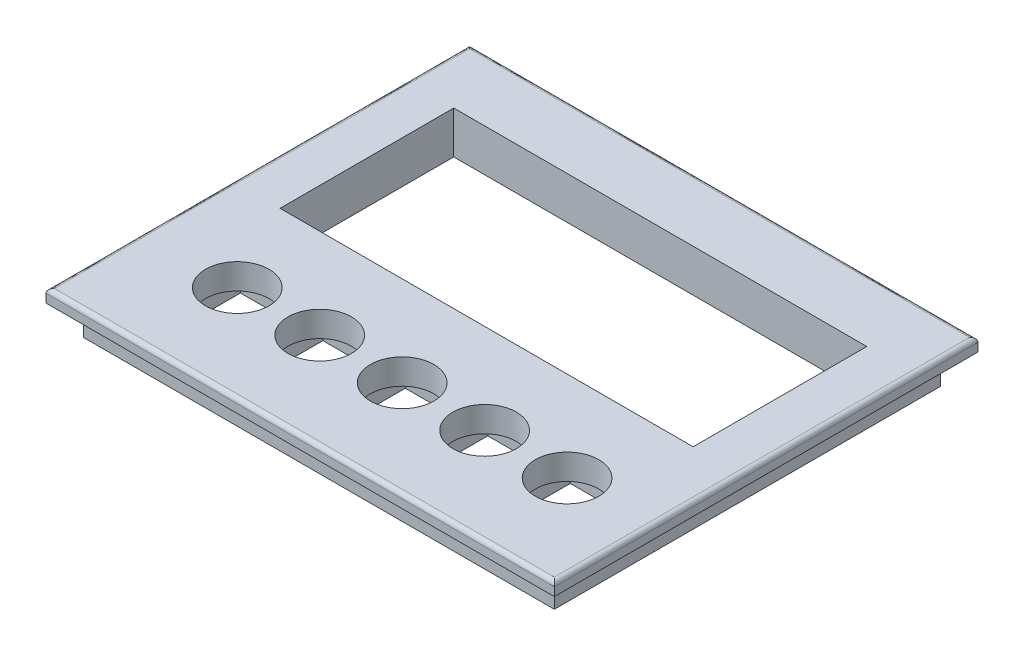
from build123d import *

# Parameters (mm, degrees)
SKETCH1_W           = 120
SKETCH1_H           = 100
BOSS_EXTRUDE1_DEPTH = 10
SKETCH2_W           = 97.5
SKETCH2_H           = 41
CUT_EXTRUDE1_DEPTH  = 10
SKETCH3_W           = 120
SKETCH3_H           = 100
SKETCH3_W_2         = 111.2
SKETCH3_H_2         = 91.2
CUT_EXTRUDE3_DEPTH  = 7
SKETCH4_W           = 17
SKETCH4_H           = 25
CUT_EXTRUDE4_DEPTH  = 4
SKETCH5_W           = 1
SKETCH5_H           = 25
CUT_EXTRUDE6_DEPTH  = 2.5
SKETCH6_R           = 7.49
CUT_EXTRUDE12_DEPTH = 80.892767694
VARFILLET1_R        = 1


with BuildPart() as part:
    # Sketch1 → Boss-Extrude1 (new body)
    with BuildSketch(Plane(origin=(0, 0, 0), x_dir=(1, 0, 0), z_dir=(0, 1, 0))):
        with Locations((0.311320755, 2.051886792)):
            Rectangle(SKETCH1_W, SKETCH1_H)
    extrude(amount=BOSS_EXTRUDE1_DEPTH)

    # Sketch2 → Cut-Extrude1 (cut)
    with BuildSketch(Plane(origin=(0, 10, 0), x_dir=(1, 0, 0), z_dir=(0, 1, 0))):
        with Locations((0.311320755, 16.551886792)):
            Rectangle(SKETCH2_W, SKETCH2_H)
    extrude(amount=-CUT_EXTRUDE1_DEPTH, mode=Mode.SUBTRACT)

    # Sketch3 → Cut-Extrude3 (cut)
    with BuildSketch(Plane.XZ):
        with Locations((0.311320755, -2.051886792)):
            Rectangle(SKETCH3_W, SKETCH3_H)
        with Locations((0.311320755, -2.051886792)):
            Rectangle(SKETCH3_W_2, SKETCH3_H_2, mode=Mode.SUBTRACT)
    extrude(amount=-CUT_EXTRUDE3_DEPTH, mode=Mode.SUBTRACT)

    # Sketch4 → Cut-Extrude4 (cut)
    with BuildSketch(Plane.XZ):
        with Locations((-37.292172289, 28.448113208)):
            Rectangle(SKETCH4_W, SKETCH4_H)
        with Locations((-17.828799028, 28.448113208)):
            Rectangle(SKETCH4_W, SKETCH4_H)
        with Locations((1.634574233, 28.448113208)):
            Rectangle(SKETCH4_W, SKETCH4_H)
        with Locations((21.097947494, 28.448113208)):
            Rectangle(SKETCH4_W, SKETCH4_H)
        with Locations((40.561320755, 28.448113208)):
            Rectangle(SKETCH4_W, SKETCH4_H)
    extrude(amount=-CUT_EXTRUDE4_DEPTH, mode=Mode.SUBTRACT)

    # Sketch5 → Cut-Extrude6 (cut)
    with BuildSketch(Plane.XZ.offset(-4)):
        with Locations((32.561320755, 28.448113208)):
            Rectangle(SKETCH5_W, SKETCH5_H)
        with Locations((13.097947494, 28.448113208)):
            Rectangle(SKETCH5_W, SKETCH5_H)
        with Locations((-6.365425767, 28.448113208)):
            Rectangle(SKETCH5_W, SKETCH5_H)
        with Locations((-25.828799028, 28.448113208)):
            Rectangle(SKETCH5_W, SKETCH5_H)
        with Locations((-45.292172289, 28.448113208)):
            Rectangle(SKETCH5_W, SKETCH5_H)
    extrude(amount=-CUT_EXTRUDE6_DEPTH, mode=Mode.SUBTRACT)

    # Sketch6 → Cut-Extrude12 (cut, through all)
    with BuildSketch(Plane.XZ.offset(-4)):
        with Locations((40.561320755, 25.198113208)):
            Circle(SKETCH6_R)
        with Locations((21.097947494, 25.198113208)):
            Circle(SKETCH6_R)
        with Locations((1.634574233, 25.198113208)):
            Circle(SKETCH6_R)
        with Locations((-17.828799028, 25.198113208)):
            Circle(SKETCH6_R)
        with Locations((-37.292172289, 25.198113208)):
            Circle(SKETCH6_R)
    extrude(amount=-CUT_EXTRUDE12_DEPTH, mode=Mode.SUBTRACT)

    # VarFillet1
    varfillet1_edges = [part.edges().sort_by_distance(p)[0] for p in [
        (0.311320755, 10, 47.948113208),
        (60.311320755, 10, -2.051886792),
        (0.311320755, 10, -52.051886792),
        (-59.688679245, 10, -2.051886792),
    ]]
    fillet(varfillet1_edges, radius=VARFILLET1_R)


solid = part.part
